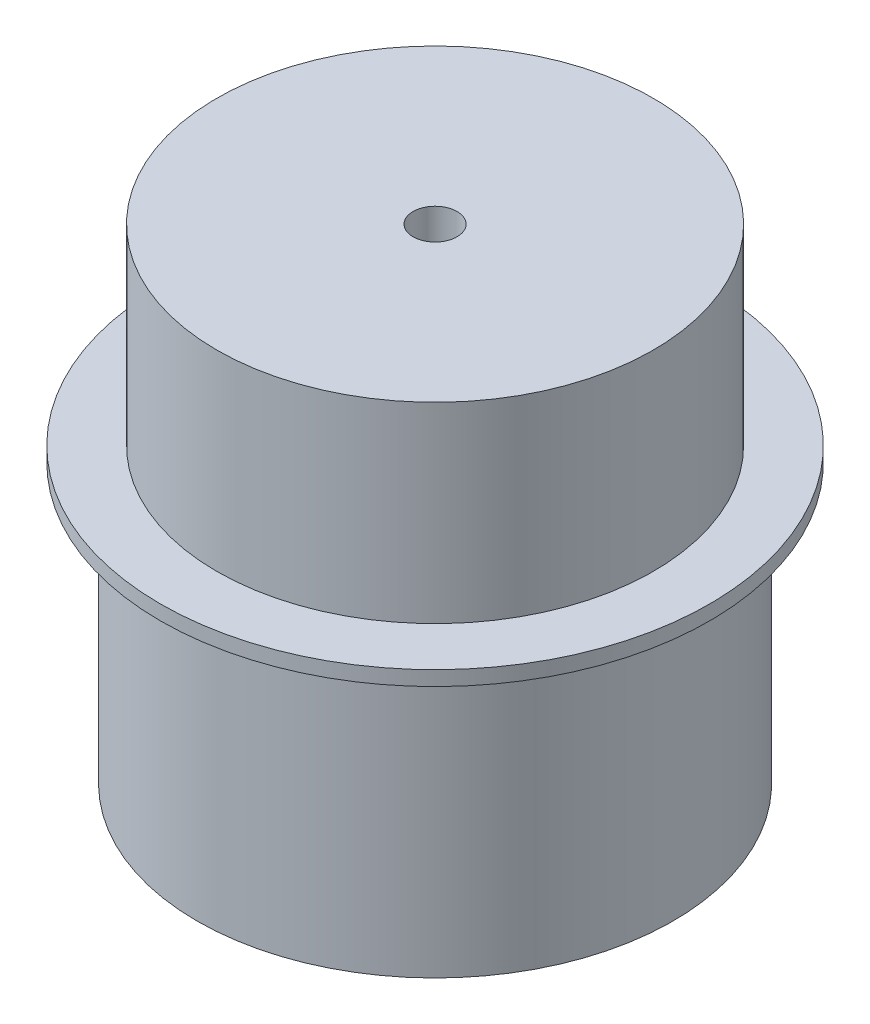
from build123d import *

# Parameters (mm, degrees)
EXTRUDE_START   = 19
SKETCH_2_R      = 29.8
SKETCH_2_R_2    = 3
EXTRUDE_1_DEPTH = 19


with BuildPart() as part:
    # Эскиз1 → Повернуть1 (revolve)
    with BuildSketch(Plane.XY):
        with BuildLine():
            Line((30.5, 14.9146265), (32.5, 14.9146265))
            Line((32.5, 14.9146265), (32.5, 52.917891733))
            Line((32.5, 52.917891733), (37.5, 52.917891733))
            Line((37.5, 52.917891733), (37.5, 54.917891733))
            Line((37.5, 54.917891733), (29.8, 54.917891733))
            Line((29.8, 54.917891733), (29.8, 62.097891733))
            Line((29.8, 62.097891733), (3, 62.097891733))
            Line((3, 62.097891733), (8.485106715, 58.931063895))
            Line((8.485106715, 58.931063895), (8.878385359, 51.42686032))
            Line((8.878385359, 51.42686032), (11.163542333, 48.951273598))
            Line((11.163542333, 48.951273598), (11.365916987, 43.156021754))
            ThreePointArc((11.365916987, 43.156021754), (12.695233654, 42.27785111), (12.484405066, 40.698668477))
            Line((12.484405066, 40.698668477), (12.738187743, 33.431283458))
            Line((12.738187743, 33.431283458), (16.954844701, 29.2146265))
            Line((16.954844701, 29.2146265), (30.5, 29.2146265))
            Line((30.5, 29.2146265), (30.5, 14.9146265))
        make_face()
    revolve(axis=Axis((0, 0, 0), (0, 1, 0)))

    # Эскиз2 → Бобышка-Вытянуть1 (add)
    with BuildSketch(Plane(origin=(0, 62.097891733, 0), x_dir=(1, 0, 0), z_dir=(0, 1, 0)).offset(EXTRUDE_START)):
        Circle(SKETCH_2_R)
        Circle(SKETCH_2_R_2, mode=Mode.SUBTRACT)
    extrude(amount=-EXTRUDE_1_DEPTH)


solid = part.part
